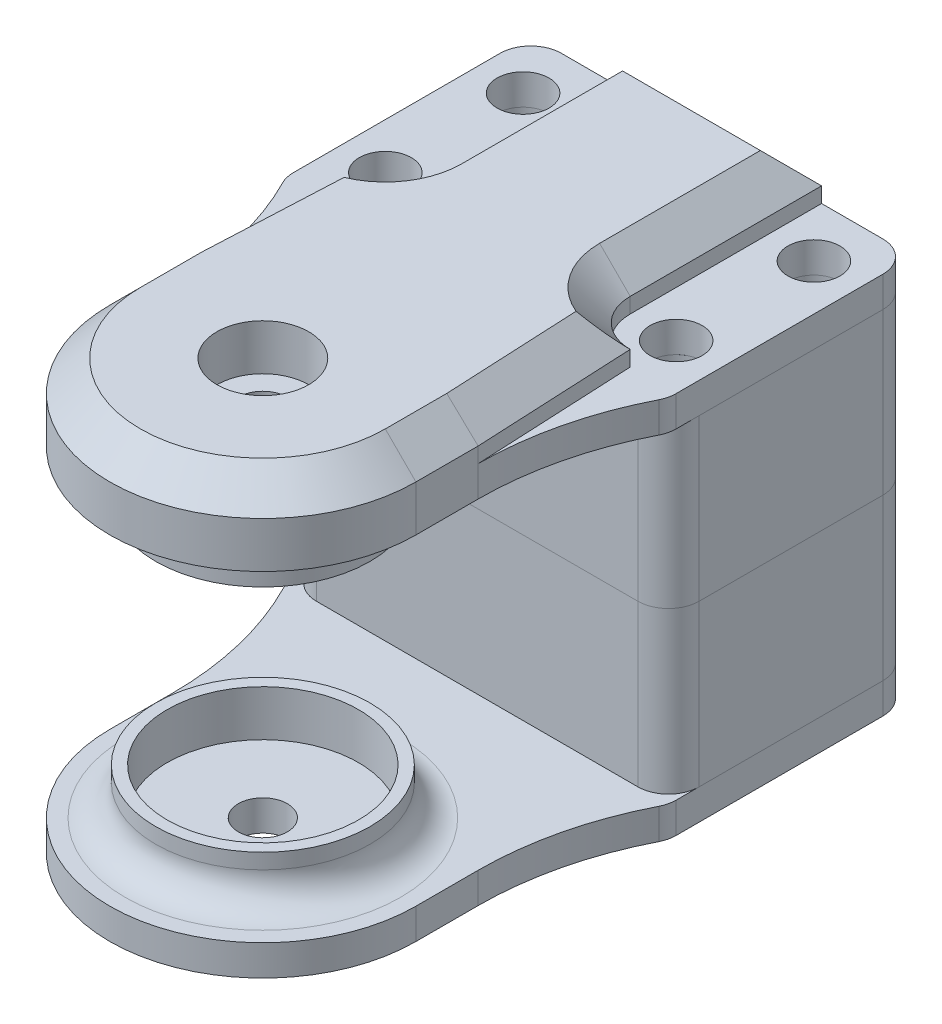
from build123d import *

# Parameters (mm, degrees)
SKETCH_2_R          = 10
EXTRUDE_1_DEPTH     = 2
SKETCH_3_R          = 7
SKETCH_3_R_2        = 6.25
EXTRUDE_2_DEPTH     = 3
CUT_EXTRUDE_1_REACH = 16.457
SKETCH_4_R          = 1.6
SKETCH_6_R          = 1.6
EXTRUDE_3_DEPTH     = 2
SKETCH_11_W         = 25
SKETCH_11_H         = 16
EXTRUDE_6_DEPTH     = 2
SKETCH_12_W         = 25
SKETCH_12_H         = 16
EXTRUDE_7_DEPTH     = 21
SKETCH_13_R         = 6.25
CUT_EXTRUDE_4_DEPTH = 13
SKETCH_14_R         = 1.7
CUT_EXTRUDE_5_DEPTH = 40.815198103
FILLET_4_R          = 21
FILLET_5_R          = 2
FILLET_6_R          = 2
CHAMFER_1_SIZE      = 0.5
FILLET_7_R          = 2
SKETCH_15_R         = 3
EXTRUDE_9_DEPTH     = 3
CHAMFER_2_SIZE      = 2


with BuildPart() as part:
    # 草图2 → 凸台-拉伸1 (new body)
    with BuildSketch(Plane(origin=(0, 0, 0), x_dir=(1, 0, 0), z_dir=(0, 1, 0))):
        with Locations(Location((0, 0, 0), (0, 0, 270))):
            Circle(SKETCH_2_R)
    extrude(amount=EXTRUDE_1_DEPTH)

    # 草图3 → 凸台-拉伸2 (add)
    with BuildSketch(Plane(origin=(0, 2, 0), x_dir=(1, 0, 0), z_dir=(0, 1, 0))):
        with Locations(Location((0, 0, 0), (0, 0, 270))):
            Circle(SKETCH_3_R)
        with Locations(Location((0, 0, 0), (0, 0, 270))):
            Circle(SKETCH_3_R_2, mode=Mode.SUBTRACT)
    extrude(amount=EXTRUDE_2_DEPTH)

    # 草图4 → 切除-拉伸1 (cut, up to next)
    with BuildSketch(Plane(origin=(0, 2, 0), x_dir=(1, 0, 0), z_dir=(0, 1, 0)), mode=Mode.PRIVATE) as cut_extrude_1_sk1:
        with Locations(Location((0, 0, 0), (0, 0, 270))):
            Circle(SKETCH_4_R)
    cut_extrude_1_tool1 = extrude(cut_extrude_1_sk1.sketch, amount=-CUT_EXTRUDE_1_REACH, mode=Mode.PRIVATE) & part.part
    add(cut_extrude_1_tool1.solids().sort_by_distance((0, 2, 0))[0], mode=Mode.SUBTRACT)

    # 草图6 → 凸台-拉伸3 (add)
    with BuildSketch(Plane.XZ):
        with BuildLine():
            Line((-10, 0), (-10, -30))
            Line((-10, -30), (10, -30))
            Line((10, -30), (10, 0))
            ThreePointArc((10, 0), (0, 10), (-10, 0))
        make_face()
        with Locations(Location((0, 0, 0), (0, 0, 90))):
            Circle(SKETCH_6_R, mode=Mode.SUBTRACT)
    extrude(amount=-EXTRUDE_3_DEPTH)

    # 草图11 → 凸台-拉伸6 (add)
    with BuildSketch(Plane.XZ):
        with Locations((0, -22)):
            Rectangle(SKETCH_11_W, SKETCH_11_H)
    extrude(amount=-EXTRUDE_6_DEPTH)


with BuildPart() as body_2:
    # 草图12 → 凸台-拉伸7 (new body)
    with BuildSketch(Plane(origin=(0, 2, 0), x_dir=(1, 0, 0), z_dir=(0, 1, 0))):
        with Locations((0, 22)):
            Rectangle(SKETCH_12_W, SKETCH_12_H)
    extrude(amount=EXTRUDE_7_DEPTH)

    # 草图13 → 切除-拉伸4 (cut)
    with BuildSketch(Plane(origin=(0, 0, -30), x_dir=(-1, 0, 0), z_dir=(0, 0, -1))):
        with Locations((0, 12.5)):
            Circle(SKETCH_13_R)
    extrude(amount=-CUT_EXTRUDE_4_DEPTH, mode=Mode.SUBTRACT)


with BuildPart() as cut_extrude_5_tool:
    # 草图14 → 切除-拉伸5 (new, through all)
    with BuildSketch(Plane(origin=(0, 23, 0), x_dir=(1, 0, 0), z_dir=(0, 1, 0))):
        with Locations(Location((9.5, 26.5, 0), (0, 0, 270))):
            Circle(SKETCH_14_R)
        with Locations(Location((-9.5, 26.5, 0), (0, 0, 270))):
            Circle(SKETCH_14_R)
        with Locations(Location((9.5, 17.5, 0), (0, 0, 270))):
            Circle(SKETCH_14_R)
        with Locations(Location((-9.5, 17.5, 0), (0, 0, 270))):
            Circle(SKETCH_14_R)
    extrude(amount=-CUT_EXTRUDE_5_DEPTH)


with BuildPart() as part_1:
    add(part.part)

    # 切除-拉伸5: cut by cut_extrude_5_tool
    add(cut_extrude_5_tool.part, mode=Mode.SUBTRACT)

    # 圆角4
    # the kernel refuses this fillet: 21 mm, written as the material it adds along each edge
    with BuildSketch(Plane(origin=(-10, 2, -14), x_dir=(0, 0, 1), z_dir=(0, -1, 0)), Plane(origin=(10, 0, -14), x_dir=(0, 0, 1), z_dir=(0, 1, 0))) as fillet_4_piece_1:
        with BuildLine():
            CenterArc((9.937303457, 21), FILLET_4_R, 241.757462816, 28.242537184)
            Line((0, 2.5), (0, 0))
            Line((0, 0), (9.937303457, 0))
        make_face()
    extrude(amount=2)

    # 圆角5
    fillet_5_edges = [part_1.edges().sort_by_distance(p)[0] for p in [
        (12.5, 1, -30),
        (-12.5, 1, -14),
        (-12.5, 1, -30),
        (12.5, 1, -14),
    ]]
    fillet(fillet_5_edges, radius=FILLET_5_R)

    # 圆角7
    fillet_7_edges = [part_1.edges().sort_by_distance(p)[0] for p in [
        (0, 2, -7),
    ]]
    fillet(fillet_7_edges, radius=FILLET_7_R)


with BuildPart() as body_2_1:
    add(body_2.part)

    # 切除-拉伸5: cut by cut_extrude_5_tool
    add(cut_extrude_5_tool.part, mode=Mode.SUBTRACT)

    # 圆角6
    fillet_6_edges = [body_2_1.edges().sort_by_distance(p)[0] for p in [
        (-12.5, 12.5, -30),
        (12.5, 12.5, -30),
        (12.5, 12.5, -14),
        (-12.5, 12.5, -14),
    ]]
    fillet(fillet_6_edges, radius=FILLET_6_R)

    # 倒角1
    chamfer_1_edges = [body_2_1.edges().sort_by_distance(p)[0] for p in [
        (6.25, 12.5, -30),
    ]]
    chamfer(chamfer_1_edges, length=CHAMFER_1_SIZE)


with BuildPart() as body_3:
    # 镜向2: mirrored copy
    add(part_1.part.mirror(Plane.ZX.offset(12.5)))

    # 草图15 → 凸台-拉伸9 (add)
    with BuildSketch(Plane(origin=(0, 25, 0), x_dir=(1, 0, 0), z_dir=(0, 1, 0))):
        with BuildLine():
            Line((-6.5, 26.5), (-6.5, 17.5))
            ThreePointArc((-6.5, 17.5), (-7.378679656, 15.378679656), (-9.5, 14.5))
            Line((-9.5, 14.5), (-10, 4.062696543))
            Line((-10, 4.062696543), (-10, 0))
            ThreePointArc((-10, 0), (0, -10), (10, 0))
            Line((10, 0), (10, 4.062696543))
            Line((10, 4.062696543), (9.5, 14.5))
            ThreePointArc((9.5, 14.5), (7.378679656, 15.378679656), (6.5, 17.5))
            Line((6.5, 17.5), (6.5, 26.5))
            Line((6.5, 26.5), (6.5, 30))
            Line((6.5, 30), (-6.5, 30))
            Line((-6.5, 30), (-6.5, 26.5))
        make_face()
        with Locations(Location((0, 0, 0), (0, 0, 270))):
            Circle(SKETCH_15_R, mode=Mode.SUBTRACT)
    extrude(amount=EXTRUDE_9_DEPTH)

    # 倒角2
    # the kernel refuses this chamfer: 2 mm, written as the material it takes off along each edge
    with BuildSketch(Plane(origin=(9.5, 28, -17.5), x_dir=(0.9895999464390007, 0, -0.1438469534189959), z_dir=(-0.1438469534189959, 0, -0.9895999464390007))) as chamfer_2_piece_1:
        Polygon((3 + CHAMFER_2_SIZE, 0), (3, CHAMFER_2_SIZE), (3, 0), align=None)
    revolve(axis=Axis((9.5, 28, -17.5), (0, -1, 0)), revolution_arc=188.27051452, mode=Mode.SUBTRACT)
    with BuildSketch(Plane(origin=(-6.5, 28, -17.5), x_dir=(0, -1, 0), z_dir=(0, 0, -1))) as chamfer_2_piece_2:
        Polygon((CHAMFER_2_SIZE, 0), (0, -CHAMFER_2_SIZE), (0, 0), align=None)
    extrude(amount=17.643365976, mode=Mode.SUBTRACT)
    with BuildSketch(Plane(origin=(-9.5, 28, -17.5), x_dir=(1, 0, 0), z_dir=(0, 0, -1))) as chamfer_2_piece_3:
        Polygon((3, CHAMFER_2_SIZE), (3 + CHAMFER_2_SIZE, 0), (3, 0), align=None)
    revolve(axis=Axis((-9.5, 28, -17.5), (0, -1, 0)), revolution_arc=188.27051452, mode=Mode.SUBTRACT)
    with BuildSketch(Plane(origin=(-9.253888809, 28, -19.637474364), x_dir=(0, -1, 0), z_dir=(-0.0478502194693744, 0, 0.9988545221886582))) as chamfer_2_piece_4:
        Polygon((CHAMFER_2_SIZE, 0), (0, CHAMFER_2_SIZE), (0, 0), align=None)
    extrude(amount=20.736004819, mode=Mode.SUBTRACT)
    with BuildSketch(Plane(origin=(6.5, 28, -35.143365976), x_dir=(-1, 0, 0), z_dir=(0, 0, 1))) as chamfer_2_piece_5:
        Polygon((CHAMFER_2_SIZE, 0), (0, CHAMFER_2_SIZE), (0, 0), align=None)
    extrude(amount=17.643365976, mode=Mode.SUBTRACT)
    with BuildSketch(Plane(origin=(11.643365976, 28, -30), x_dir=(0, -1, 0), z_dir=(-1, 0, 0))) as chamfer_2_piece_6:
        Polygon((CHAMFER_2_SIZE, 0), (0, CHAMFER_2_SIZE), (0, 0), align=None)
    extrude(amount=23.286731952, mode=Mode.SUBTRACT)
    with BuildSketch(Plane(origin=(-10, 28, -9.206062519), x_dir=(0, -1, 0), z_dir=(0, 0, 1)), Plane(origin=(10, 28, 0), x_dir=(0, -1, 0), z_dir=(0, 0, -1))) as chamfer_2_piece_7:
        Polygon((CHAMFER_2_SIZE, 0), (0, CHAMFER_2_SIZE), (0, 0), align=None)
    extrude(amount=9.206062519, mode=Mode.SUBTRACT)
    with BuildSketch(Plane(origin=(0, 28, 0), x_dir=(-1, 0, 0), z_dir=(0, 0, -1))) as chamfer_2_piece_8:
        Polygon((10, -CHAMFER_2_SIZE), (10 - CHAMFER_2_SIZE, 0), (10, 0), align=None)
    revolve(axis=Axis((0, 28, 0), (0, 1, 0)), revolution_arc=180, mode=Mode.SUBTRACT)
    with BuildSketch(Plane(origin=(10.246111191, 28, 1.074777822), x_dir=(-0.9988545221886582, 0, 0.04785021946937484), z_dir=(-0.04785021946937484, 0, -0.9988545221886582))) as chamfer_2_piece_9:
        Polygon((CHAMFER_2_SIZE, 0), (0, -CHAMFER_2_SIZE), (0, 0), align=None)
    extrude(amount=20.736004819, mode=Mode.SUBTRACT)


with BuildPart() as body_4:
    # Split Bodies 2: the piece on the far side of the plane
    add(body_2_1.part)
    split(bisect_by=Plane.ZX.offset(12.5), keep=Keep.BOTTOM)


with BuildPart() as body_2_2:
    add(body_2_1.part)

    # Split Bodies 2
    split(bisect_by=Plane.ZX.offset(12.5), keep=Keep.TOP)


solid = Compound([part_1.part, body_3.part, body_4.part, body_2_2.part])
